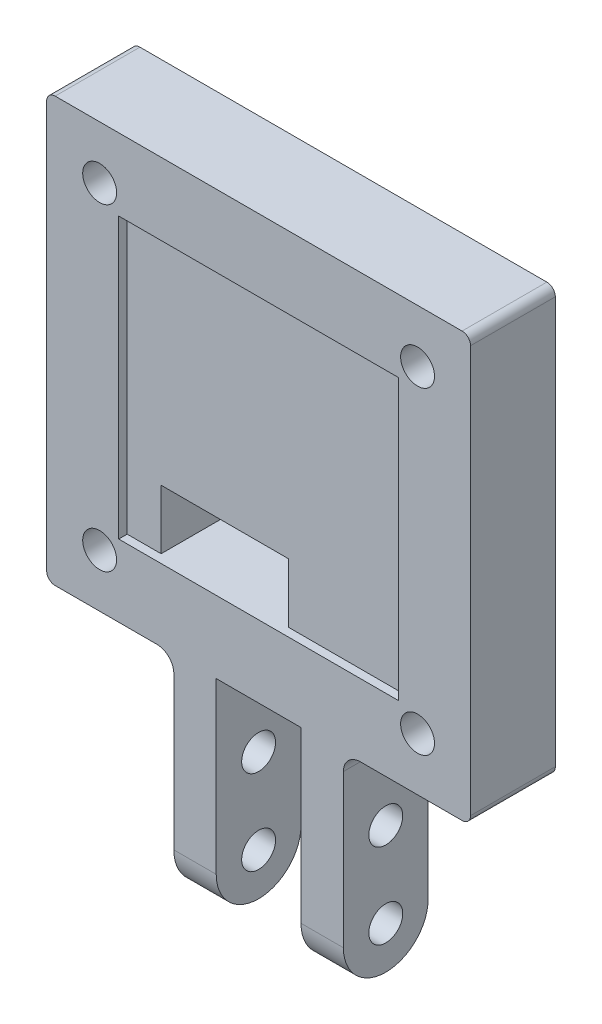
from build123d import *

# Parameters (mm, degrees)
SKETCH1_W           = 50
SKETCH1_H           = 50
BOSS_EXTRUDE1_DEPTH = 10
SKETCH2_W           = 5
SKETCH2_H           = 10
BOSS_EXTRUDE2_DEPTH = 25
SKETCH3_R           = 2
CUT_EXTRUDE1_DEPTH  = 25
SKETCH4_R           = 2
CUT_EXTRUDE2_DEPTH  = 25
FILLET2_R           = 5
FILLET3_R           = 5
FILLET4_R           = 1
FILLET5_R           = 2
FILLET6_R           = 2
SKETCH5_W           = 33
SKETCH5_H           = 33
CUT_EXTRUDE3_DEPTH  = 1
SKETCH6_W           = 15
SKETCH6_H           = 7
CUT_EXTRUDE4_DEPTH  = 16


with BuildPart() as part:
    # Sketch1 → Boss-Extrude1 (new body)
    with BuildSketch(Plane.XY):
        with Locations((25, 25)):
            Rectangle(SKETCH1_W, SKETCH1_H)
    extrude(amount=BOSS_EXTRUDE1_DEPTH)

    # Sketch2 → Boss-Extrude2 (add)
    with BuildSketch(Plane.XZ):
        with Locations((17.5, 5)):
            Rectangle(SKETCH2_W, SKETCH2_H)
        with Locations((32.5, 5)):
            Rectangle(SKETCH2_W, SKETCH2_H)
    extrude(amount=BOSS_EXTRUDE2_DEPTH)

    # Sketch3 → Cut-Extrude1 (cut)
    with BuildSketch(Plane.XY.offset(10)):
        with Locations((43.75, 43.75)):
            Circle(SKETCH3_R)
        with Locations((6.25, 43.75)):
            Circle(SKETCH3_R)
        with Locations((6.25, 6.25)):
            Circle(SKETCH3_R)
        with Locations((43.75, 6.25)):
            Circle(SKETCH3_R)
    extrude(amount=-CUT_EXTRUDE1_DEPTH, mode=Mode.SUBTRACT)

    # Sketch4 → Cut-Extrude2 (cut)
    with BuildSketch(Plane(origin=(35, 0, 0), x_dir=(0, 0, -1), z_dir=(1, 0, 0))):
        with Locations((-5, -10)):
            Circle(SKETCH4_R)
        with Locations((-5, -20)):
            Circle(SKETCH4_R)
    extrude(amount=-CUT_EXTRUDE2_DEPTH, mode=Mode.SUBTRACT)

    # Fillet2
    fillet2_edges = [part.edges().sort_by_distance(p)[0] for p in [
        (32.5, -25, 10),
    ]]
    fillet(fillet2_edges, radius=FILLET2_R)

    # Fillet3
    fillet3_edges = [part.edges().sort_by_distance(p)[0] for p in [
        (17.5, -25, 10),
        (17.5, -25, 0),
        (32.5, -25, 0),
    ]]
    fillet(fillet3_edges, radius=FILLET3_R - 0.0001)  # a hair under: the kernel refuses the full size

    # Fillet4
    fillet4_edges = [part.edges().sort_by_distance(p)[0] for p in [
        (0, 50, 5),
        (50, 50, 5),
        (50, 0, 5),
        (0, 0, 5),
    ]]
    fillet(fillet4_edges, radius=FILLET4_R)

    # Fillet5
    fillet5_edges = [part.edges().sort_by_distance(p)[0] for p in [
        (15, 0, 5),
    ]]
    fillet(fillet5_edges, radius=FILLET5_R)

    # Fillet6
    fillet6_edges = [part.edges().sort_by_distance(p)[0] for p in [
        (35, 0, 5),
    ]]
    fillet(fillet6_edges, radius=FILLET6_R)

    # Sketch5 → Cut-Extrude3 (cut)
    with BuildSketch(Plane.XY.offset(10)):
        with Locations((25, 25)):
            Rectangle(SKETCH5_W, SKETCH5_H)
    extrude(amount=-CUT_EXTRUDE3_DEPTH, mode=Mode.SUBTRACT)

    # Sketch6 → Cut-Extrude4 (cut)
    with BuildSketch(Plane.XY.offset(9)):
        with Locations((20, 12)):
            Rectangle(SKETCH6_W, SKETCH6_H)
    extrude(amount=-CUT_EXTRUDE4_DEPTH, mode=Mode.SUBTRACT)


solid = part.part
